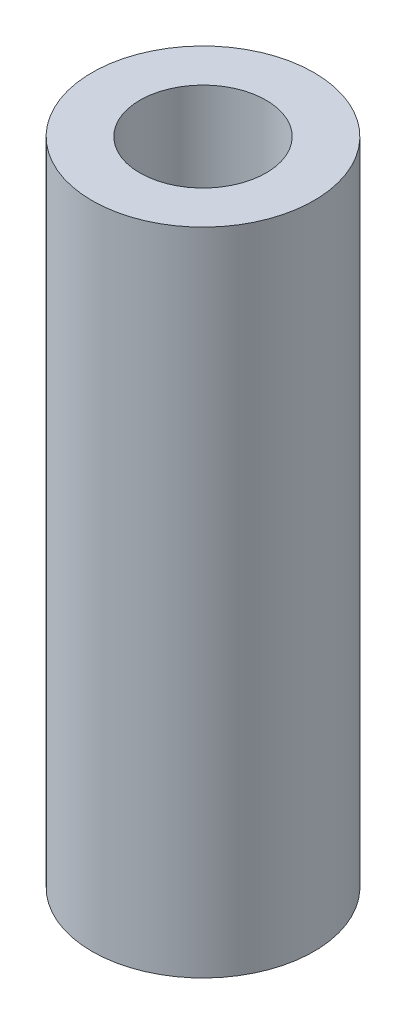
from build123d import *

# Parameters (mm, degrees)
SKETCH1_R           = 10
BOSS_EXTRUDE1_DEPTH = 58.608286993
SKETCH2_R           = 5.687349945
CUT_EXTRUDE1_DEPTH  = 61.290391475


with BuildPart() as part:
    # Sketch1 → Boss-Extrude1 (new body)
    with BuildSketch(Plane(origin=(0, 0, 0), x_dir=(1, 0, 0), z_dir=(0, 1, 0))):
        Circle(SKETCH1_R)
    extrude(amount=BOSS_EXTRUDE1_DEPTH)

    # Sketch2 → Cut-Extrude1 (cut, through all)
    with BuildSketch(Plane(origin=(0, 0, 0), x_dir=(1, 0, 0), z_dir=(0, 1, 0))):
        Circle(SKETCH2_R)
    extrude(amount=CUT_EXTRUDE1_DEPTH, mode=Mode.SUBTRACT)


solid = part.part
